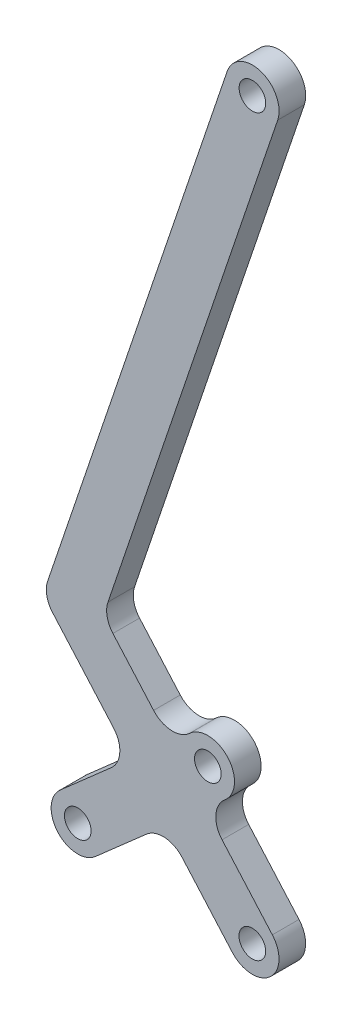
from build123d import *

# Parameters (mm, degrees)
SKETCH1_R           = 6.35
BOSS_EXTRUDE2_DEPTH = 12.7


with BuildPart() as part:
    # Sketch1 → Boss-Extrude2 (new body)
    with BuildSketch(Plane.XY):
        with BuildLine():
            Line((-47.861608451, 100.119085271), (-133.442564505, -153.144622963))
            ThreePointArc((-133.442564505, -153.144622963), (-133.840252568, -159.34353641), (-131.08520381, -164.910796961))
            Line((-131.08520381, -164.910796961), (-102.004159404, -197.978993548))
            ThreePointArc((-102.004159404, -197.978993548), (-99.039903459, -206.671889136), (-103.090663398, -214.914740035))
            Line((-103.090663398, -214.914740035), (-127.458247902, -236.344236656))
            ThreePointArc((-127.458247902, -236.344236656), (-128.608131295, -254.267901688), (-110.684466263, -255.417785081))
            Line((-110.684466263, -255.417785081), (-86.316881759, -233.98828846))
            ThreePointArc((-86.316881759, -233.98828846), (-77.62398617, -231.024032515), (-69.381135272, -235.074792454))
            Line((-69.381135272, -235.074792454), (-45.409156001, -262.333446306))
            ThreePointArc((-45.409156001, -262.333446306), (-27.485490969, -263.483329699), (-26.335607575, -245.559664667))
            Line((-26.335607575, -245.559664667), (-50.307586847, -218.301010815))
            ThreePointArc((-50.307586847, -218.301010815), (-53.271842792, -209.608115227), (-49.221082853, -201.365264328))
            Line((-49.221082853, -201.365264328), (-48.695433881, -200.902994755))
            ThreePointArc((-48.695433881, -200.902994755), (-47.545550487, -182.979329723), (-65.469215519, -181.82944633))
            Line((-65.469215519, -181.82944633), (-65.994864492, -182.291715903))
            ThreePointArc((-65.994864492, -182.291715903), (-74.68776008, -185.255971848), (-82.930610979, -181.205211909))
            Line((-82.930610979, -181.205211909), (-102.32730804, -159.14913364))
            ThreePointArc((-102.32730804, -159.14913364), (-105.082356798, -153.581873088), (-104.684668735, -147.382959642))
            Line((-104.684668735, -147.382959642), (-23.798313222, 91.987798614))
            ThreePointArc((-23.798313222, 91.987798614), (-31.764317508, 108.085089558), (-47.861608451, 100.119085271))
        make_face()
        with Locations((-57.0823247, -191.366220543)):
            Circle(SKETCH1_R, mode=Mode.SUBTRACT)
        with Locations((-119.071357082, -245.881010869)):
            Circle(SKETCH1_R, mode=Mode.SUBTRACT)
        with Locations((-35.872381788, -253.946555486)):
            Circle(SKETCH1_R, mode=Mode.SUBTRACT)
        with Locations((-35.829960836, 96.053441943)):
            Circle(SKETCH1_R, mode=Mode.SUBTRACT)
    extrude(amount=BOSS_EXTRUDE2_DEPTH)


solid = part.part
